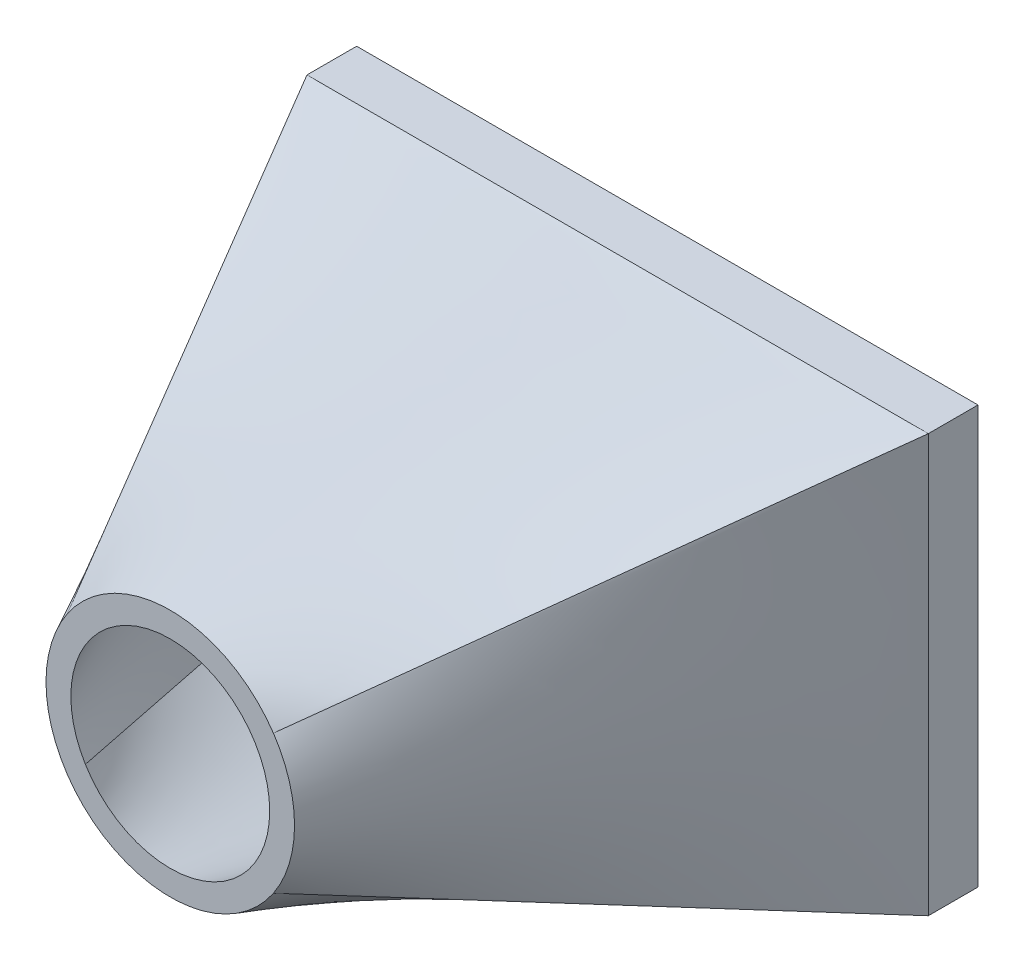
from build123d import *

# Parameters (mm, degrees)
SKETCH1_W           = 12.5
SKETCH1_H           = 8.4
SKETCH1_W_2         = 10.5
SKETCH1_H_2         = 6.4
BOSS_EXTRUDE1_DEPTH = 1


with BuildPart() as part:
    # Sketch1 → Boss-Extrude1 (new body)
    with BuildSketch(Plane.XY):
        Rectangle(SKETCH1_W, SKETCH1_H)
        Rectangle(SKETCH1_W_2, SKETCH1_H_2, mode=Mode.SUBTRACT)
    extrude(amount=BOSS_EXTRUDE1_DEPTH)

    # Sketch3 → Loft1 section 0
    with BuildSketch(Plane.XY.offset(1)):
        with BuildLine():
            Line((6.25, -4.2), (6.25, 4.2))
            Line((6.25, 4.2), (-6.25, 4.2))
            Line((-6.25, 4.2), (-6.25, -4.2))
            Line((-6.25, -4.2), (6.25, -4.2))
        make_face()
    # Sketch2 for Loft1 → Loft1 section 1
    with BuildSketch(Plane.XY.offset(10)):
        with BuildLine():
            # circular arc as an exact rational Bezier (weights 1, cos(half-angle), 1)
            Bezier((2.075003924, -1.394402637), (3.012042497, 0), (2.075003924, 1.394402637), weights=[1, 0.830001569, 1])
            Bezier((2.075003924, 1.394402637), (0, 4.482206096), (-2.075003924, 1.394402637), weights=[1, 0.557761055, 1])
            Bezier((-2.075003924, 1.394402637), (-3.012042497, 0), (-2.075003924, -1.394402637), weights=[1, 0.830001569, 1])
            Bezier((-2.075003924, -1.394402637), (0, -4.482206096), (2.075003924, -1.394402637), weights=[1, 0.557761055, 1])
        make_face()
    loft()

    # Cut-Loft1: read off the stored shape, not the designer's step
    # Cut-Loft1: loft between two sections, ruled curve by curve
    cut_loft1_from = [
        Edge.make_bspline([(1.707768655, -1.040925656, 10), (1.633699479, -1.162445397, 10), (1.542008876, -1.28354475, 10), (1.31984949, -1.511051231, 10), (1.189256111, -1.617336715, 10), (0.892947872, -1.797985608, 10), (0.72722112, -1.87212471, 10), (0.374256765, -1.973229171, 10), (0.187198335, -2, 10), (-0.187198335, -2, 10), (-0.374256765, -1.973229171, 10), (-0.72722112, -1.87212471, 10), (-0.892947872, -1.797985608, 10), (-1.189256111, -1.617336715, 10), (-1.31984949, -1.511051231, 10), (-1.542008876, -1.28354475, 10), (-1.633699479, -1.162445397, 10), (-1.707768655, -1.040925656, 10)], [0, 0, 0, 0, 0.125, 0.125, 0.25, 0.25, 0.375, 0.375, 0.5, 0.5, 0.625, 0.625, 0.75, 0.75, 0.875, 0.875, 1, 1, 1, 1], 3),
        Edge.make_bspline([(-1.707768655, -1.040925656, 10), (-1.798062507, -0.892787306, 10), (-1.872174068, -0.727085204, 10), (-1.973239973, -0.374182636, 10), (-2, -0.187161202, 10), (-2, 0.187161202, 10), (-1.973239973, 0.374182636, 10), (-1.872174068, 0.727085204, 10), (-1.798062507, 0.892787306, 10), (-1.707768655, 1.040925656, 10)], [0, 0, 0, 0, 0.25, 0.25, 0.5, 0.5, 0.75, 0.75, 1, 1, 1, 1], 3),
        Edge.make_bspline([(1.707768655, 1.040925656, 10), (1.798062507, 0.892787306, 10), (1.872174068, 0.727085204, 10), (1.973239973, 0.374182636, 10), (2, 0.187161202, 10), (2, -0.187161202, 10), (1.973239973, -0.374182636, 10), (1.872174068, -0.727085204, 10), (1.798062507, -0.892787306, 10), (1.707768655, -1.040925656, 10)], [0, 0, 0, 0, 0.25, 0.25, 0.5, 0.5, 0.75, 0.75, 1, 1, 1, 1], 3),
        Edge.make_bspline([(-1.707768655, 1.040925656, 10), (-1.633699479, 1.162445397, 10), (-1.542008876, 1.28354475, 10), (-1.31984949, 1.511051231, 10), (-1.189256111, 1.617336715, 10), (-0.892947872, 1.797985608, 10), (-0.72722112, 1.87212471, 10), (-0.374256765, 1.973229171, 10), (-0.187198335, 2, 10), (0.187198335, 2, 10), (0.374256765, 1.973229171, 10), (0.72722112, 1.87212471, 10), (0.892947872, 1.797985608, 10), (1.189256111, 1.617336715, 10), (1.31984949, 1.511051231, 10), (1.542008876, 1.28354475, 10), (1.633699479, 1.162445397, 10), (1.707768655, 1.040925656, 10)], [0, 0, 0, 0, 0.125, 0.125, 0.25, 0.25, 0.375, 0.375, 0.5, 0.5, 0.625, 0.625, 0.75, 0.75, 0.875, 0.875, 1, 1, 1, 1], 3),
    ]
    cut_loft1_to = [
        Edge.make_bspline([(5.25, -3.2, 1), (4.8125, -3.2, 1), (4.375, -3.2, 1), (3.5, -3.2, 1), (3.0625, -3.2, 1), (2.1875, -3.2, 1), (1.75, -3.2, 1), (0.875, -3.2, 1), (0.4375, -3.2, 1), (-0.4375, -3.2, 1), (-0.875, -3.2, 1), (-1.75, -3.2, 1), (-2.1875, -3.2, 1), (-3.0625, -3.2, 1), (-3.5, -3.2, 1), (-4.375, -3.2, 1), (-4.8125, -3.2, 1), (-5.25, -3.2, 1)], [0, 0, 0, 0, 0.125, 0.125, 0.25, 0.25, 0.375, 0.375, 0.5, 0.5, 0.625, 0.625, 0.75, 0.75, 0.875, 0.875, 1, 1, 1, 1], 3),
        Edge.make_bspline([(-5.25, -3.2, 1), (-5.25, -2.666666667, 1), (-5.25, -2.133333333, 1), (-5.25, -1.066666667, 1), (-5.25, -0.533333333, 1), (-5.25, 0.533333333, 1), (-5.25, 1.066666667, 1), (-5.25, 2.133333333, 1), (-5.25, 2.666666667, 1), (-5.25, 3.2, 1)], [0, 0, 0, 0, 0.25, 0.25, 0.5, 0.5, 0.75, 0.75, 1, 1, 1, 1], 3),
        Edge.make_bspline([(5.25, 3.2, 1), (5.25, 2.666666667, 1), (5.25, 2.133333333, 1), (5.25, 1.066666667, 1), (5.25, 0.533333333, 1), (5.25, -0.533333333, 1), (5.25, -1.066666667, 1), (5.25, -2.133333333, 1), (5.25, -2.666666667, 1), (5.25, -3.2, 1)], [0, 0, 0, 0, 0.25, 0.25, 0.5, 0.5, 0.75, 0.75, 1, 1, 1, 1], 3),
        Edge.make_bspline([(-5.25, 3.2, 1), (-4.8125, 3.2, 1), (-4.375, 3.2, 1), (-3.5, 3.2, 1), (-3.0625, 3.2, 1), (-2.1875, 3.2, 1), (-1.75, 3.2, 1), (-0.875, 3.2, 1), (-0.4375, 3.2, 1), (0.4375, 3.2, 1), (0.875, 3.2, 1), (1.75, 3.2, 1), (2.1875, 3.2, 1), (3.0625, 3.2, 1), (3.5, 3.2, 1), (4.375, 3.2, 1), (4.8125, 3.2, 1), (5.25, 3.2, 1)], [0, 0, 0, 0, 0.125, 0.125, 0.25, 0.25, 0.375, 0.375, 0.5, 0.5, 0.625, 0.625, 0.75, 0.75, 0.875, 0.875, 1, 1, 1, 1], 3),
    ]
    cut_loft1 = Solid(Shell([*[Face.make_surface_from_curves(cut_loft1_from[k], cut_loft1_to[k]) for k in range(4)], Face(Wire(cut_loft1_from)), Face(Wire(cut_loft1_to))]))
    add(cut_loft1, mode=Mode.SUBTRACT)


solid = part.part
